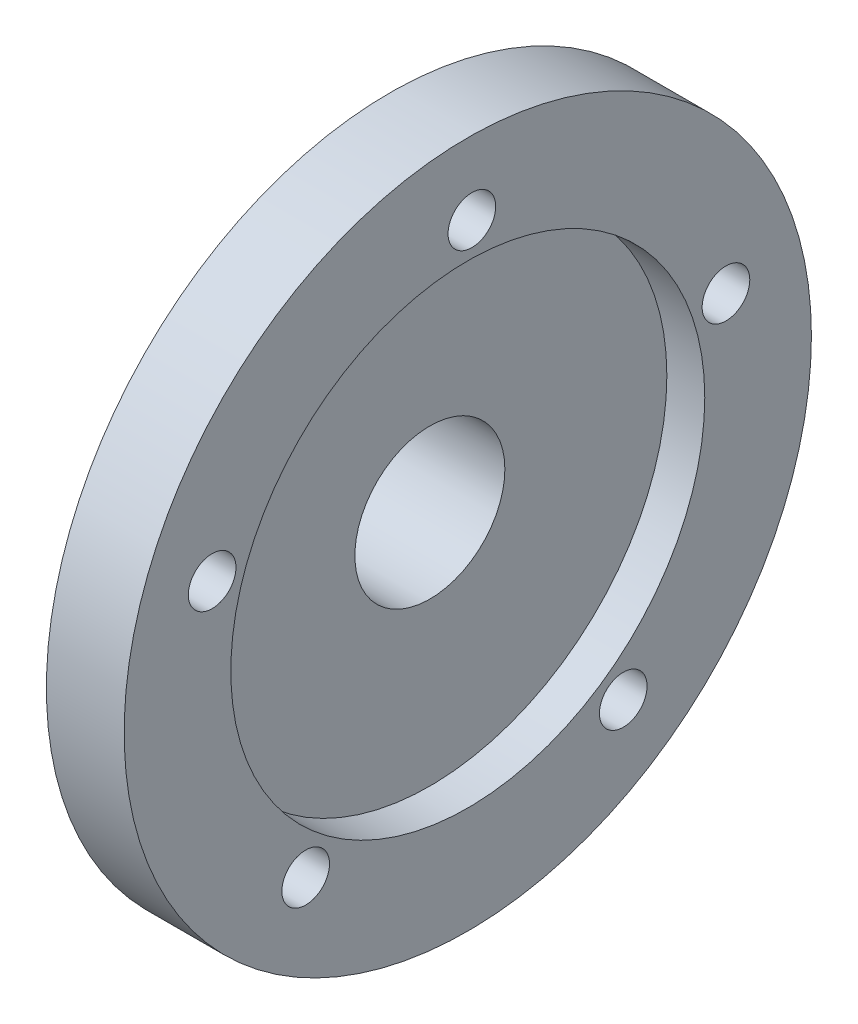
from build123d import *

# Parameters (mm, degrees)
SKETCH2_R          = 2.5527
CUT_EXTRUDE1_DEPTH = 56.074558476


with BuildPart() as part:
    # Sketch1 → Revolve1 (revolve)
    with BuildSketch(Plane.XY):
        Polygon((-27.857278892, 8.0391), (-14.024094998, 8.0391), (-14.024094998, 25.4), (-9.960094998, 25.4), (-9.960094998, 36.83), (-18.295757287, 36.83), (-27.857278892, 17.801339222), align=None)
    revolve(axis=Axis((0, 0, 0), (-1, 0, 0)))

    # Sketch2 → Cut-Extrude1 (cut, through all)
    with BuildSketch(Plane(origin=(-9.960094998, 0, 0), x_dir=(0, 0, -1), z_dir=(1, 0, 0))):
        with Locations((16.663235389, -23.68093162)):
            Circle(SKETCH2_R)
        with Locations((-17.372681413, -23.165488912)):
            Circle(SKETCH2_R)
        with Locations((0.438461756, 28.95268014)):
            Circle(SKETCH2_R)
        with Locations((27.671127245, 8.529868286)):
            Circle(SKETCH2_R)
        with Locations((-27.400142977, 9.363872106)):
            Circle(SKETCH2_R)
    extrude(amount=-CUT_EXTRUDE1_DEPTH, mode=Mode.SUBTRACT)


solid = part.part
